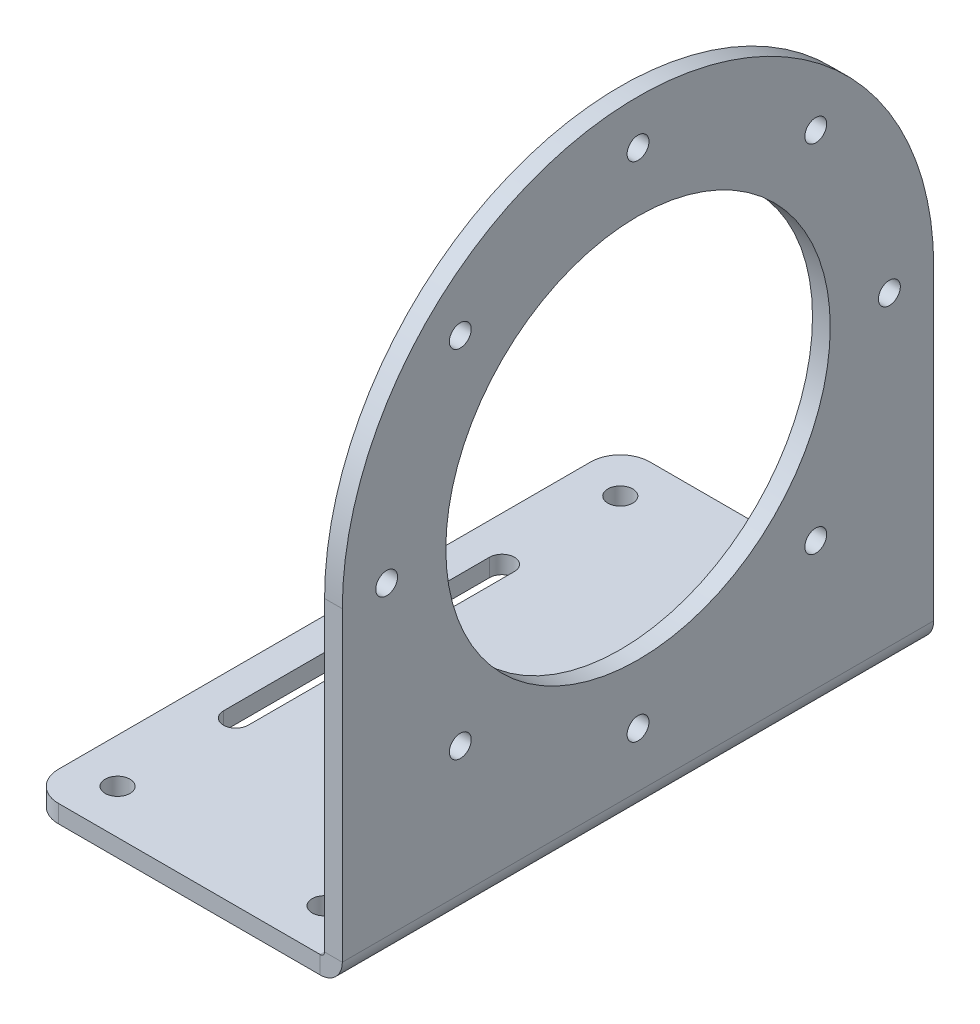
from build123d import *

# Parameters (mm, degrees)
SKETCH_1_R                       = 1.85
SKETCH_1_R_2                     = 32.5
SM_BASE_FLANGE_1_DEPTH           = 3
SM_EDGE_FLANGE_1_STRIP_W         = 13.4732
SM_EDGE_FLANGE_1_STRIP_H         = 3
SM_EDGE_FLANGE_1_STRIP_CUT_DEPTH = 100
SM_EDGE_FLANGE_1_DEPTH           = 100
SKETCH_9_R                       = 2.1
CUT_EXTRUDE_1_DEPTH              = 10
FILLET_1_R                       = 5
SKETCH_10_R                      = 2.1
CUT_EXTRUDE_2_DEPTH              = 10


# Sheet-metal steps are written as plain solids
with BuildPart() as part:
    # Sketch 1 → 基体-法兰1 (new body)
    with BuildSketch(Plane(origin=(0, 0, 0), x_dir=(0, 0, -1), z_dir=(1, 0, 0))):
        with BuildLine():
            Line((-50, 0), (-50, -55.5))
            Line((-50, -55.5), (50, -55.5))
            Line((50, -55.5), (50, 0))
            ThreePointArc((50, 0), (0, 50), (-50, 0))
        make_face()
        with Locations((0, 42.5)):
            Circle(SKETCH_1_R, mode=Mode.SUBTRACT)
        with Locations((30.0520382, 30.0520382)):
            Circle(SKETCH_1_R, mode=Mode.SUBTRACT)
        with Locations((42.5, 0)):
            Circle(SKETCH_1_R, mode=Mode.SUBTRACT)
        with Locations((30.0520382, -30.0520382)):
            Circle(SKETCH_1_R, mode=Mode.SUBTRACT)
        with Locations((0, -42.5)):
            Circle(SKETCH_1_R, mode=Mode.SUBTRACT)
        with Locations((-30.0520382, -30.0520382)):
            Circle(SKETCH_1_R, mode=Mode.SUBTRACT)
        with Locations((-42.5, 0)):
            Circle(SKETCH_1_R, mode=Mode.SUBTRACT)
        with Locations((-30.0520382, 30.0520382)):
            Circle(SKETCH_1_R, mode=Mode.SUBTRACT)
        Circle(SKETCH_1_R_2, mode=Mode.SUBTRACT)
    extrude(amount=-SM_BASE_FLANGE_1_DEPTH)

    # 边线-法兰1 strip (across the edge) → 边线-法兰1 strip cut (cut)
    with BuildSketch(Plane(origin=(-3, -55.5, -50), x_dir=(0, 1, 0), z_dir=(0, 0, 1))):
        with Locations((-3, -1.5)):
            Rectangle(SM_EDGE_FLANGE_1_STRIP_W, SM_EDGE_FLANGE_1_STRIP_H)
    extrude(amount=SM_EDGE_FLANGE_1_STRIP_CUT_DEPTH, mode=Mode.SUBTRACT)

    # 边线-法兰1 section (across the edge) → 边线-法兰1 (add)
    with BuildSketch(Plane(origin=(-3, -55.5, -50), x_dir=(0, 1, 0), z_dir=(0, 0, 1))):
        with BuildLine():
            Line((0, 0.7366), (0, 50))
            Line((0, 50), (3, 50))
            Line((3, 50), (3, 0.7366))
            ThreePointArc((3, 0.7366), (3.215745145, 0.215745145), (3.7366, 0))
            Line((3.7366, 0), (3.7366, -3))
            ThreePointArc((3.7366, -3), (1.094424801, -1.905575199), (0, 0.7366))
        make_face()
    extrude(amount=SM_EDGE_FLANGE_1_DEPTH)

    # 草图9 → 切除-拉伸1 (cut)
    with BuildSketch(Plane(origin=(0, -52.5, 0), x_dir=(1, 0, 0), z_dir=(0, 1, 0))):
        with Locations(Location((-45.5, 42.5, 0), (0, 0, 180))):
            Circle(SKETCH_9_R)
        with Locations(Location((-10.5, 42.5, 0), (0, 0, 180))):
            Circle(SKETCH_9_R)
        with Locations(Location((-45.5, -42.5, 0), (0, 0, 180))):
            Circle(SKETCH_9_R)
        with Locations(Location((-10.5, -42.5, 0), (0, 0, 180))):
            Circle(SKETCH_9_R)
    extrude(amount=-CUT_EXTRUDE_1_DEPTH, mode=Mode.SUBTRACT)

    # 圆角1
    fillet_1_edges = [part.edges().sort_by_distance(p)[0] for p in [
        (-53, -54, -50),
        (-53, -54, 50),
    ]]
    fillet(fillet_1_edges, radius=FILLET_1_R)

    # 草图10 → 切除-拉伸2 (cut)
    with BuildSketch(Plane(origin=(0, -52.5, 0), x_dir=(1, 0, 0), z_dir=(0, 1, 0))):
        with Locations(Location((-28, 0, 0), (0, 0, 180))):
            Circle(SKETCH_10_R)
        with BuildLine():
            Line((-43.4, 22.5), (-43.4, -22.5))
            ThreePointArc((-43.4, -22.5), (-45.5, -24.6), (-47.6, -22.5))
            Line((-47.6, -22.5), (-47.6, 22.5))
            ThreePointArc((-47.6, 22.5), (-45.5, 24.6), (-43.4, 22.5))
        make_face()
        with BuildLine():
            Line((-8.4, 22.5), (-8.4, -22.5))
            ThreePointArc((-8.4, -22.5), (-10.5, -24.6), (-12.6, -22.5))
            Line((-12.6, -22.5), (-12.6, 22.5))
            ThreePointArc((-12.6, 22.5), (-10.5, 24.6), (-8.4, 22.5))
        make_face()
    extrude(amount=-CUT_EXTRUDE_2_DEPTH, mode=Mode.SUBTRACT)


solid = part.part
